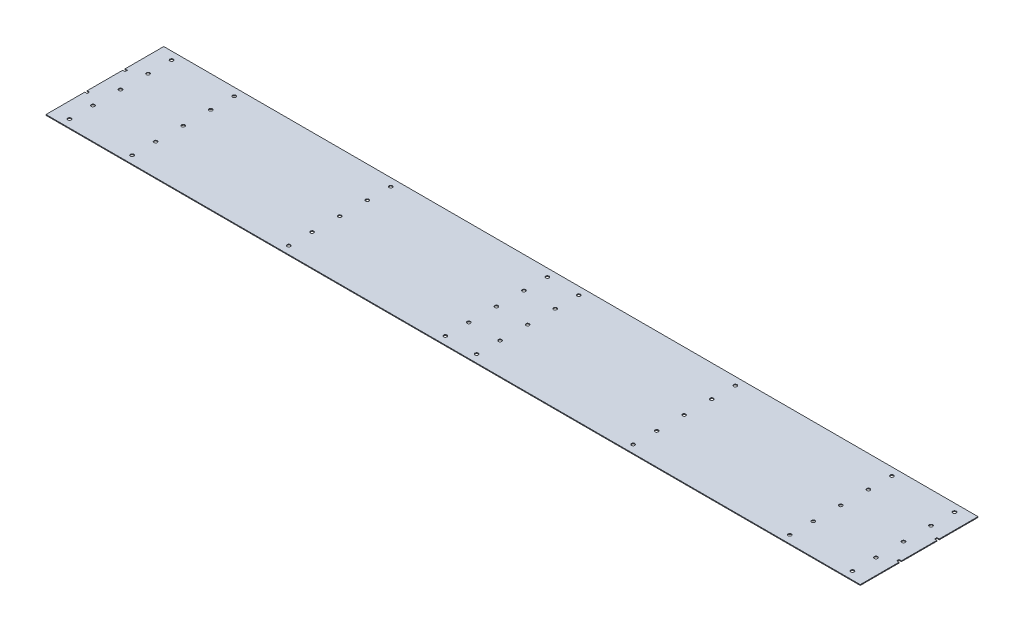
from build123d import *

# Parameters (mm, degrees)
SKETCH1_R           = 2.15
BOSS_EXTRUDE1_DEPTH = 1


with BuildPart() as part:
    # Sketch1 → Boss-Extrude1 (new body)
    with BuildSketch(Plane(origin=(0, 0, 0), x_dir=(1, 0, 0), z_dir=(0, 1, 0))):
        Polygon((-497, -25.7), (-500, -25.7), (-500, -75.2), (540, -75.2), (540, -25.7), (537, -25.7), (537, -22.7), (540, -22.7), (540, 22.7), (537, 22.7), (537, 25.7), (540, 25.7), (540, 75.2), (-500, 75.2), (-500, 25.7), (-497, 25.7), (-497, 22.7), (-500, 22.7), (-500, -22.7), (-497, -22.7), align=None)
        with Locations((-480, -65.2)):
            Circle(SKETCH1_R, mode=Mode.SUBTRACT)
        with Locations((-400, -65.2)):
            Circle(SKETCH1_R, mode=Mode.SUBTRACT)
        with Locations((-200, -65.2)):
            Circle(SKETCH1_R, mode=Mode.SUBTRACT)
        with Locations((0, -65.2)):
            Circle(SKETCH1_R, mode=Mode.SUBTRACT)
        with Locations((-480, -35.2)):
            Circle(SKETCH1_R, mode=Mode.SUBTRACT)
        with Locations((-400, -35.2)):
            Circle(SKETCH1_R, mode=Mode.SUBTRACT)
        with Locations((-480, 0)):
            Circle(SKETCH1_R, mode=Mode.SUBTRACT)
        with Locations((-400, 0)):
            Circle(SKETCH1_R, mode=Mode.SUBTRACT)
        with Locations((-200, -35.2)):
            Circle(SKETCH1_R, mode=Mode.SUBTRACT)
        with Locations((0, -35.2)):
            Circle(SKETCH1_R, mode=Mode.SUBTRACT)
        with Locations((-200, 0)):
            Circle(SKETCH1_R, mode=Mode.SUBTRACT)
        Circle(SKETCH1_R, mode=Mode.SUBTRACT)
        with Locations((40, -65.2)):
            Circle(SKETCH1_R, mode=Mode.SUBTRACT)
        with Locations((240, -65.2)):
            Circle(SKETCH1_R, mode=Mode.SUBTRACT)
        with Locations((440, -65.2)):
            Circle(SKETCH1_R, mode=Mode.SUBTRACT)
        with Locations((520, -65.2)):
            Circle(SKETCH1_R, mode=Mode.SUBTRACT)
        with Locations((40, -35.2)):
            Circle(SKETCH1_R, mode=Mode.SUBTRACT)
        with Locations((240, -35.2)):
            Circle(SKETCH1_R, mode=Mode.SUBTRACT)
        with Locations((40, 0)):
            Circle(SKETCH1_R, mode=Mode.SUBTRACT)
        with Locations((240, 0)):
            Circle(SKETCH1_R, mode=Mode.SUBTRACT)
        with Locations((440, -35.2)):
            Circle(SKETCH1_R, mode=Mode.SUBTRACT)
        with Locations((520, -35.2)):
            Circle(SKETCH1_R, mode=Mode.SUBTRACT)
        with Locations((440, 0)):
            Circle(SKETCH1_R, mode=Mode.SUBTRACT)
        with Locations((520, 0)):
            Circle(SKETCH1_R, mode=Mode.SUBTRACT)
        with Locations((-480, 35.2)):
            Circle(SKETCH1_R, mode=Mode.SUBTRACT)
        with Locations((-400, 35.2)):
            Circle(SKETCH1_R, mode=Mode.SUBTRACT)
        with Locations((-200, 35.2)):
            Circle(SKETCH1_R, mode=Mode.SUBTRACT)
        with Locations((0, 35.2)):
            Circle(SKETCH1_R, mode=Mode.SUBTRACT)
        with Locations((-480, 65.2)):
            Circle(SKETCH1_R, mode=Mode.SUBTRACT)
        with Locations((-400, 65.2)):
            Circle(SKETCH1_R, mode=Mode.SUBTRACT)
        with Locations((-200, 65.2)):
            Circle(SKETCH1_R, mode=Mode.SUBTRACT)
        with Locations((0, 65.2)):
            Circle(SKETCH1_R, mode=Mode.SUBTRACT)
        with Locations((40, 35.2)):
            Circle(SKETCH1_R, mode=Mode.SUBTRACT)
        with Locations((240, 35.2)):
            Circle(SKETCH1_R, mode=Mode.SUBTRACT)
        with Locations((440, 35.2)):
            Circle(SKETCH1_R, mode=Mode.SUBTRACT)
        with Locations((520, 35.2)):
            Circle(SKETCH1_R, mode=Mode.SUBTRACT)
        with Locations((40, 65.2)):
            Circle(SKETCH1_R, mode=Mode.SUBTRACT)
        with Locations((240, 65.2)):
            Circle(SKETCH1_R, mode=Mode.SUBTRACT)
        with Locations((440, 65.2)):
            Circle(SKETCH1_R, mode=Mode.SUBTRACT)
        with Locations((520, 65.2)):
            Circle(SKETCH1_R, mode=Mode.SUBTRACT)
    extrude(amount=BOSS_EXTRUDE1_DEPTH)


solid = part.part
